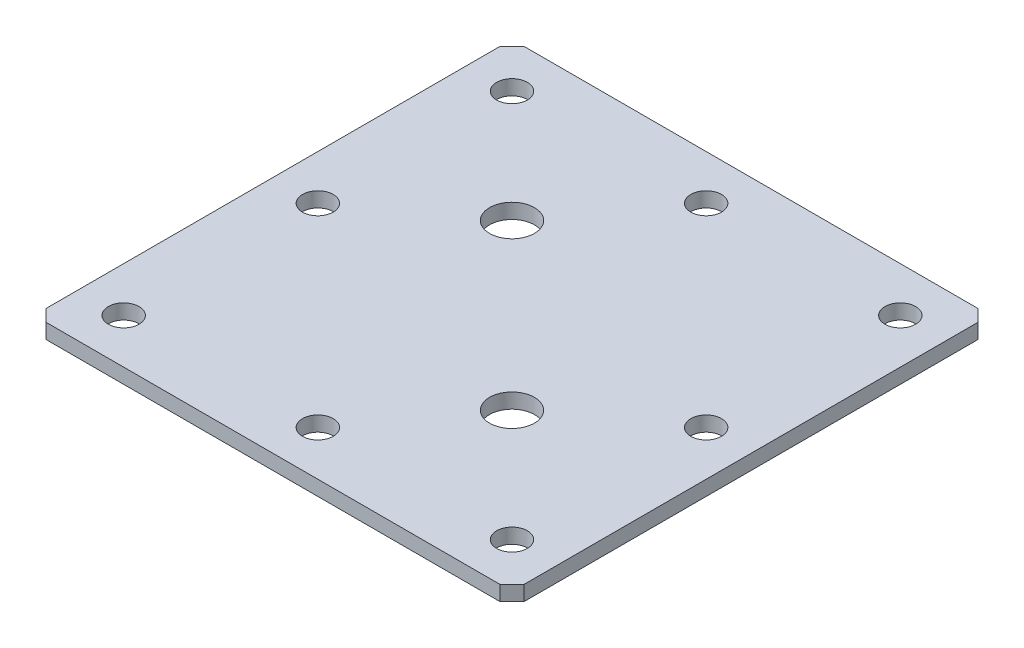
from build123d import *

# Parameters (mm, degrees)
SKETCH1_R           = 3.2639
SKETCH1_R_2         = 4.7625
BOSS_EXTRUDE1_DEPTH = 3.175


with BuildPart() as part:
    # Sketch1 → Boss-Extrude1 (new body)
    with BuildSketch(Plane(origin=(0, 0, 0), x_dir=(1, 0, 0), z_dir=(0, 1, 0))):
        Polygon((-54.870471859, 24.482838448), (-57.410471859, 21.942838448), (-57.410471859, -74.577161552), (-54.870471859, -77.117161552), (41.649528141, -77.117161552), (44.189528141, -74.577161552), (44.189528141, 21.942838448), (41.649528141, 24.482838448), align=None)
        with Locations((-47.885471859, -67.592161552)):
            Circle(SKETCH1_R, mode=Mode.SUBTRACT)
        with Locations((-6.610471859, -67.592161552)):
            Circle(SKETCH1_R, mode=Mode.SUBTRACT)
        with Locations((-47.885471859, -26.317161552)):
            Circle(SKETCH1_R, mode=Mode.SUBTRACT)
        with Locations((34.664528141, -67.592161552)):
            Circle(SKETCH1_R, mode=Mode.SUBTRACT)
        with Locations((-47.885471859, 14.957838448)):
            Circle(SKETCH1_R, mode=Mode.SUBTRACT)
        with Locations((-6.610471859, 14.957838448)):
            Circle(SKETCH1_R, mode=Mode.SUBTRACT)
        with Locations((34.664528141, -26.317161552)):
            Circle(SKETCH1_R, mode=Mode.SUBTRACT)
        with Locations((34.664528141, 14.957838448)):
            Circle(SKETCH1_R, mode=Mode.SUBTRACT)
        with Locations((10.852028141, -43.779661552)):
            Circle(SKETCH1_R_2, mode=Mode.SUBTRACT)
        with Locations((-24.072971859, -8.854661552)):
            Circle(SKETCH1_R_2, mode=Mode.SUBTRACT)
    extrude(amount=BOSS_EXTRUDE1_DEPTH)


solid = part.part
